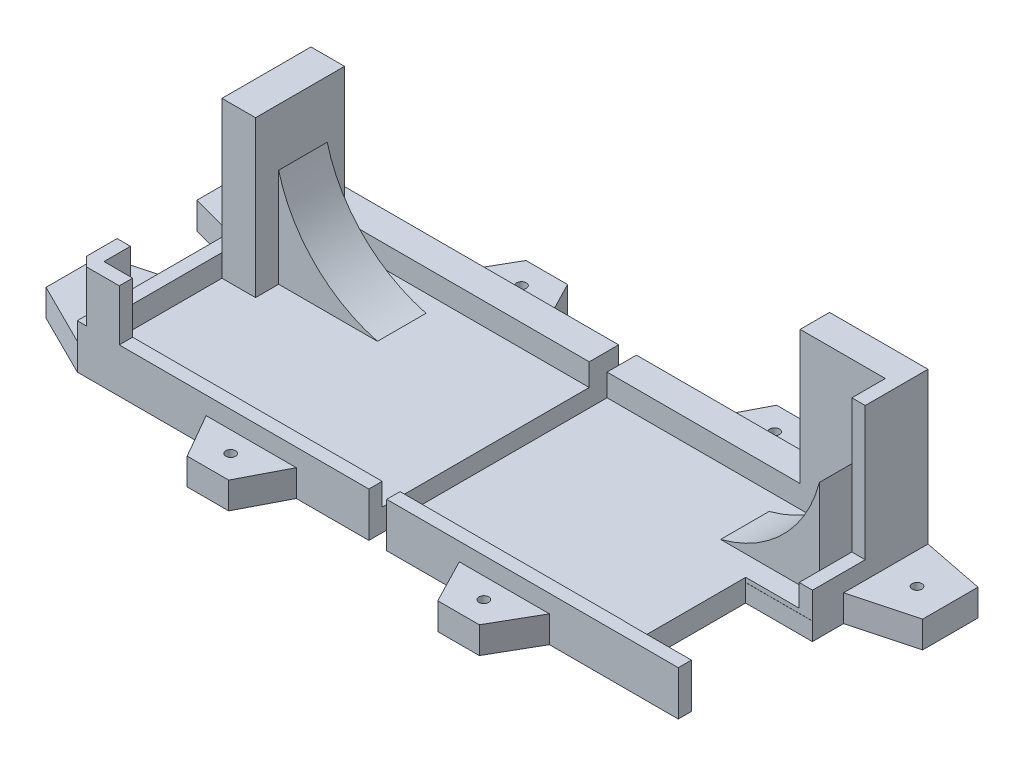
from build123d import *

# Parameters (mm, degrees)
SKETCH3_W               = 270
SKETCH3_H               = 112.2
BOSS_EXTRUDE1_DEPTH     = 20
CUT_EXTRUDE1_START      = 10
SKETCH2_W               = 258
SKETCH2_H               = 93
CUT_EXTRUDE1_DEPTH      = 30
SKETCH5_W               = 27.15
SKETCH5_H               = 8
CUT_EXTRUDE2_DEPTH      = 30
SKETCH7_W               = 27.2
SKETCH7_H               = 12
CUT_EXTRUDE3_DEPTH      = 30
BOSS_EXTRUDE6_DEPTH     = 23
BOSS_EXTRUDE7_DEPTH     = 12
SKETCH27_R              = 2.1825
CUT_EXTRUDE4_DEPTH      = 12
BOSS_EXTRUDE10_START    = 7.8
BOSS_EXTRUDE10_DEPTH    = 21.8
SKETCH34_W              = 15.08
SKETCH34_H              = 40
BOSS_EXTRUDE11_DEPTH    = 70
BOSS_EXTRUDE12_DEPTH    = 60
CUT_EXTRUDE5_DEPTH      = 207.856979578
CUT_EXTRUDE5_DEPTH_BACK = 207.856979578
SKETCH38_W              = 8
SKETCH38_H              = 28.101502088


with BuildPart() as part:
    # Sketch3 → Boss-Extrude1 (new body)
    with BuildSketch(Plane(origin=(0, 0, 0), x_dir=(1, 0, 0), z_dir=(0, 1, 0))):
        with Locations((0, 23)):
            Rectangle(SKETCH3_W, SKETCH3_H)
    extrude(amount=BOSS_EXTRUDE1_DEPTH)

    # Sketch2 → Cut-Extrude1 (cut)
    with BuildSketch(Plane(origin=(0, 0, 0), x_dir=(1, 0, 0), z_dir=(0, 1, 0)).offset(CUT_EXTRUDE1_START)):
        with Locations((0, 19.4)):
            Rectangle(SKETCH2_W, SKETCH2_H)
    extrude(amount=CUT_EXTRUDE1_DEPTH, mode=Mode.SUBTRACT)

    # Sketch5 → Cut-Extrude2 (cut)
    with BuildSketch(Plane(origin=(135, 0, 0), x_dir=(0, 0, -1), z_dir=(1, 0, 0))):
        with Locations((13.575, 4)):
            Rectangle(SKETCH5_W, SKETCH5_H)
    cut_extrude2 = extrude(amount=-CUT_EXTRUDE2_DEPTH, mode=Mode.SUBTRACT)

    # Mirror1: Cut-Extrude2 across plane
    add(cut_extrude2.mirror(Plane.XY), mode=Mode.SUBTRACT)

    # Sketch7 → Cut-Extrude3 (cut)
    with BuildSketch(Plane(origin=(135, 0, 0), x_dir=(0, 0, -1), z_dir=(1, 0, 0))):
        with Locations((13.6, 14)):
            Rectangle(SKETCH7_W, SKETCH7_H)
    cut_extrude3 = extrude(amount=-CUT_EXTRUDE3_DEPTH, mode=Mode.SUBTRACT)

    # Mirror2: Cut-Extrude3 across plane
    add(cut_extrude3.mirror(Plane.XY), mode=Mode.SUBTRACT)

    # Sketch23 → Boss-Extrude6 (add)
    with BuildSketch(Plane(origin=(0, 20, 0), x_dir=(1, 0, 0), z_dir=(0, 1, 0))):
        Polygon((-135, -15.201290187), (-129, -15.201290187), (-129, -27.1), (-116.129520543, -27.1), (-116.129520543, -33.1), (-130.748790546, -33.1), (-135, -28.848790546), align=None)
    extrude(amount=BOSS_EXTRUDE6_DEPTH)

    # Sketch26 → Boss-Extrude7 (add)
    with BuildSketch(Plane(origin=(0, 0, 0), x_dir=(1, 0, 0), z_dir=(0, 1, 0))):
        Polygon((-135, 41.199092499), (-135, 79.1), (-163, 73.546424044), (-163, 48.655333625), align=None)
        Polygon((-135, 13.200907501), (-163, 5.744666375), (-163, -19.146424044), (-135, -33.1), align=None)
        Polygon((-77.113011714, -33.1), (-36.620106691, -33.1), (-46.95788024, -53.1), (-65.621461612, -53.1), align=None)
        Polygon((36.620106691, -33.1), (77.113011714, -33.1), (65.621461612, -53.1), (46.95788024, -53.1), align=None)
        Polygon((65.621461612, 99.1), (77.113011714, 79.1), (36.620106691, 79.1), (46.95788024, 99.1), align=None)
        Polygon((-65.621461612, 99.1), (-77.113011714, 79.1), (-36.620106691, 79.1), (-46.95788024, 99.1), align=None)
        Polygon((163, 48.655333625), (135, 41.199092499), (135, 79.1), (163, 73.546424044), align=None)
    extrude(amount=BOSS_EXTRUDE7_DEPTH)

    # Sketch27 → Cut-Extrude4 (cut)
    with BuildSketch(Plane(origin=(0, 12, 0), x_dir=(1, 0, 0), z_dir=(0, 1, 0))):
        with Locations((-56.866559202, -42.309979601)):
            Circle(SKETCH27_R)
        with Locations((56.866559202, -42.309979601)):
            Circle(SKETCH27_R)
        with Locations((-149.002974589, 60.14954625)):
            Circle(SKETCH27_R)
        with Locations((-149.002974589, -9.94954625)):
            Circle(SKETCH27_R)
        with Locations((56.866559202, 88.309979601)):
            Circle(SKETCH27_R)
        with Locations((-56.866559202, 88.309979601)):
            Circle(SKETCH27_R)
        with Locations((149.002974589, 60.14954625)):
            Circle(SKETCH27_R)
    extrude(amount=-CUT_EXTRUDE4_DEPTH, mode=Mode.SUBTRACT)

    # Sketch32 → Boss-Extrude10 (add)
    with BuildSketch(Plane.XY.offset(-65.9).offset(BOSS_EXTRUDE10_START)):
        with BuildLine():
            Line((84.617950873, 10), (129, 10))
            Line((129, 10), (129, 54.379725349))
            ThreePointArc((129, 54.379725349), (112.839595195, 26.158927146), (84.617950873, 10))
        make_face()
        with BuildLine():
            Line((-69.537950873, 10), (-113.92, 10))
            Line((-113.92, 10), (-113.92, 54.379725349))
            ThreePointArc((-113.92, 54.379725349), (-97.759595195, 26.158927146), (-69.537950873, 10))
        make_face()
    extrude(amount=BOSS_EXTRUDE10_DEPTH)

    # Sketch34 → Boss-Extrude11 (add)
    with BuildSketch(Plane(origin=(0, 10, 0), x_dir=(1, 0, 0), z_dir=(0, 1, 0))):
        with Locations((-121.46, 45.9)):
            Rectangle(SKETCH34_W, SKETCH34_H)
    extrude(amount=BOSS_EXTRUDE11_DEPTH)

    # Sketch36 → Boss-Extrude12 (add)
    with BuildSketch(Plane(origin=(0, 20, 0), x_dir=(1, 0, 0), z_dir=(0, 1, 0))):
        Polygon((135, 79.1), (135, 50.889116573), (129, 50.889116573), (129, 65.9), (90.745815543, 65.9), (90.745815543, 79.1), align=None)
    extrude(amount=BOSS_EXTRUDE12_DEPTH)

    # Sketch38 → Cut-Extrude5 (cut, two sides: drawn at the far end of the back side and taken through both)
    with BuildSketch(Plane.XY.offset(-CUT_EXTRUDE5_DEPTH_BACK)):
        with Locations((0, 14.050751044)):
            Rectangle(SKETCH38_W, SKETCH38_H)
    extrude(amount=CUT_EXTRUDE5_DEPTH + CUT_EXTRUDE5_DEPTH_BACK, mode=Mode.SUBTRACT)


with BuildPart() as cut_extrude5_piece_1:
    # of the separate pieces the step leaves, piece 1, a body of its own (cut_extrude5_pieces)
    add(part.part.solids().sort_by_distance((-135, 0, 33.1))[0])


with BuildPart() as cut_extrude5_piece_2:
    # of the separate pieces the step leaves, piece 2, a body of its own (cut_extrude5_pieces)
    add(part.part.solids().sort_by_distance((4, 0, 33.1))[0])


solid = Compound([cut_extrude5_piece_1.part, cut_extrude5_piece_2.part])
